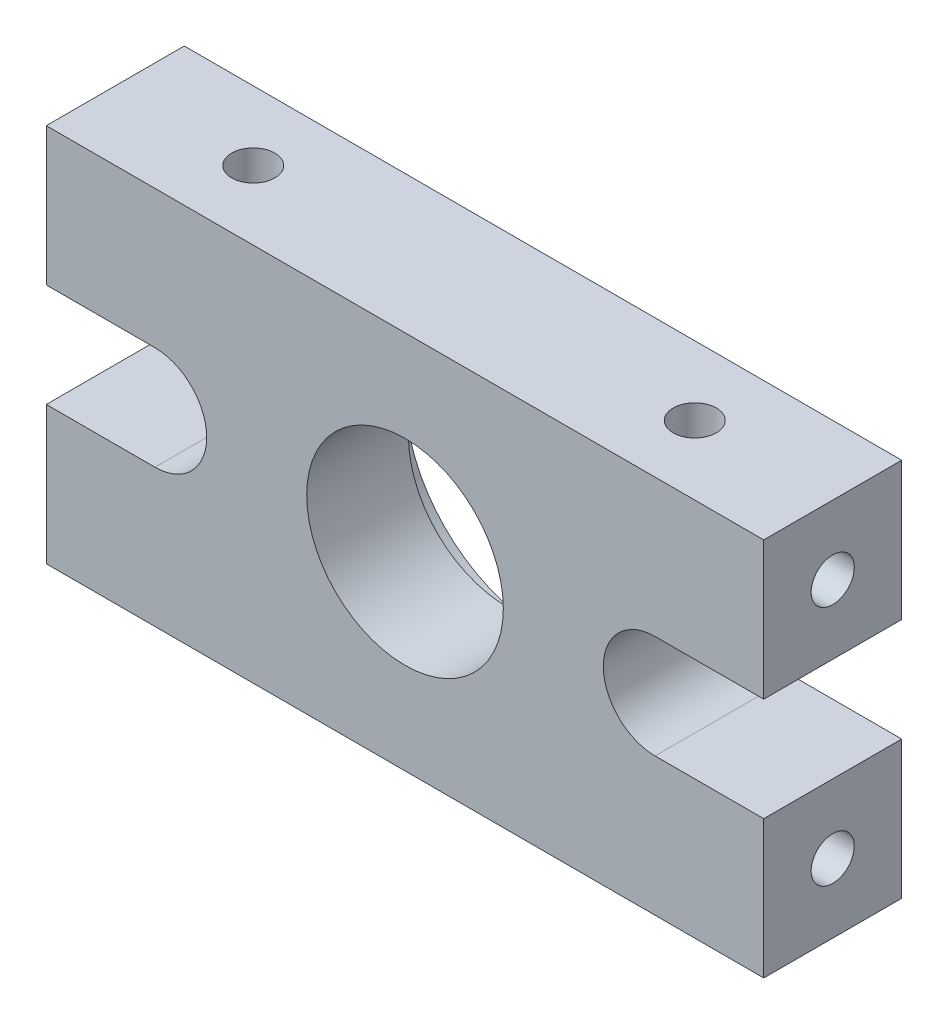
from build123d import *

# Parameters (mm, degrees)
SKETCH1_R                       = 5.7
BOSS_EXTRUDE1_DEPTH             = 8
TAP_DRILL_FOR_M3X0_5_TAP1_D     = 2.5
TAP_DRILL_FOR_M3X0_5_TAP1_DEPTH = 5
TAP_DRILL_FOR_M3X0_5_TAP1_TIP   = 0.751075774
TAP_DRILL_FOR_M3X0_5_TAP2_D     = 2.5
TAP_DRILL_FOR_M3X0_5_TAP2_DEPTH = 5
TAP_DRILL_FOR_M3X0_5_TAP2_TIP   = 0.751075774
TAP_DRILL_FOR_M3X0_5_TAP3_D     = 2.5
TAP_DRILL_FOR_M3X0_5_TAP3_DEPTH = 5
TAP_DRILL_FOR_M3X0_5_TAP3_TIP   = 0.751075774
SKETCH8_R                       = 8
CUT_EXTRUDE1_DEPTH              = 2.1


with BuildPart() as part:
    # Sketch1 → Boss-Extrude1 (new body)
    with BuildSketch(Plane.XY):
        with BuildLine():
            Line((0, 0), (41.6, 0))
            Line((41.6, 0), (41.6, 8))
            Line((41.6, 8), (35.3, 8))
            ThreePointArc((35.3, 8), (32.3, 11), (35.3, 14))
            Line((35.3, 14), (41.6, 14))
            Line((41.6, 14), (41.6, 22))
            Line((41.6, 22), (0, 22))
            Line((0, 22), (0, 14))
            Line((0, 14), (6.3, 14))
            ThreePointArc((6.3, 14), (9.3, 11), (6.3, 8))
            Line((6.3, 8), (0, 8))
            Line((0, 8), (0, 0))
        make_face()
        with Locations((20.8, 11)):
            Circle(SKETCH1_R, mode=Mode.SUBTRACT)
    extrude(amount=BOSS_EXTRUDE1_DEPTH)

    # Tap Drill for M3x0.5 Tap1
    with Locations(Plane(origin=(41.6, 0, 0), x_dir=(0, 0, -1), z_dir=(1, 0, 0))):
        with Locations((-4, 18), (-4, 4)):
            Hole(TAP_DRILL_FOR_M3X0_5_TAP1_D / 2, depth=TAP_DRILL_FOR_M3X0_5_TAP1_DEPTH)
            with Locations((0, 0, -(TAP_DRILL_FOR_M3X0_5_TAP1_DEPTH + TAP_DRILL_FOR_M3X0_5_TAP1_TIP / 2))):  # 118° drill point
                Cone(0, TAP_DRILL_FOR_M3X0_5_TAP1_D / 2, TAP_DRILL_FOR_M3X0_5_TAP1_TIP, mode=Mode.SUBTRACT)

    # Tap Drill for M3x0.5 Tap2
    with Locations(Plane.ZY):
        with Locations((4, 4), (4, 18)):
            Hole(TAP_DRILL_FOR_M3X0_5_TAP2_D / 2, depth=TAP_DRILL_FOR_M3X0_5_TAP2_DEPTH)
            with Locations((0, 0, -(TAP_DRILL_FOR_M3X0_5_TAP2_DEPTH + TAP_DRILL_FOR_M3X0_5_TAP2_TIP / 2))):  # 118° drill point
                Cone(0, TAP_DRILL_FOR_M3X0_5_TAP2_D / 2, TAP_DRILL_FOR_M3X0_5_TAP2_TIP, mode=Mode.SUBTRACT)

    # Tap Drill for M3x0.5 Tap3
    with Locations(Plane(origin=(0, 22, 0), x_dir=(1, 0, 0), z_dir=(0, 1, 0))):
        with Locations((33.6, -4), (8, -4)):
            Hole(TAP_DRILL_FOR_M3X0_5_TAP3_D / 2, depth=TAP_DRILL_FOR_M3X0_5_TAP3_DEPTH)
            with Locations((0, 0, -(TAP_DRILL_FOR_M3X0_5_TAP3_DEPTH + TAP_DRILL_FOR_M3X0_5_TAP3_TIP / 2))):  # 118° drill point
                Cone(0, TAP_DRILL_FOR_M3X0_5_TAP3_D / 2, TAP_DRILL_FOR_M3X0_5_TAP3_TIP, mode=Mode.SUBTRACT)

    # Sketch8 → Cut-Extrude1 (cut)
    with BuildSketch(Plane(origin=(0, 0, 0), x_dir=(-1, 0, 0), z_dir=(0, 0, -1))):
        with Locations((-20.8, 11)):
            Circle(SKETCH8_R)
    extrude(amount=-CUT_EXTRUDE1_DEPTH, mode=Mode.SUBTRACT)


solid = part.part
